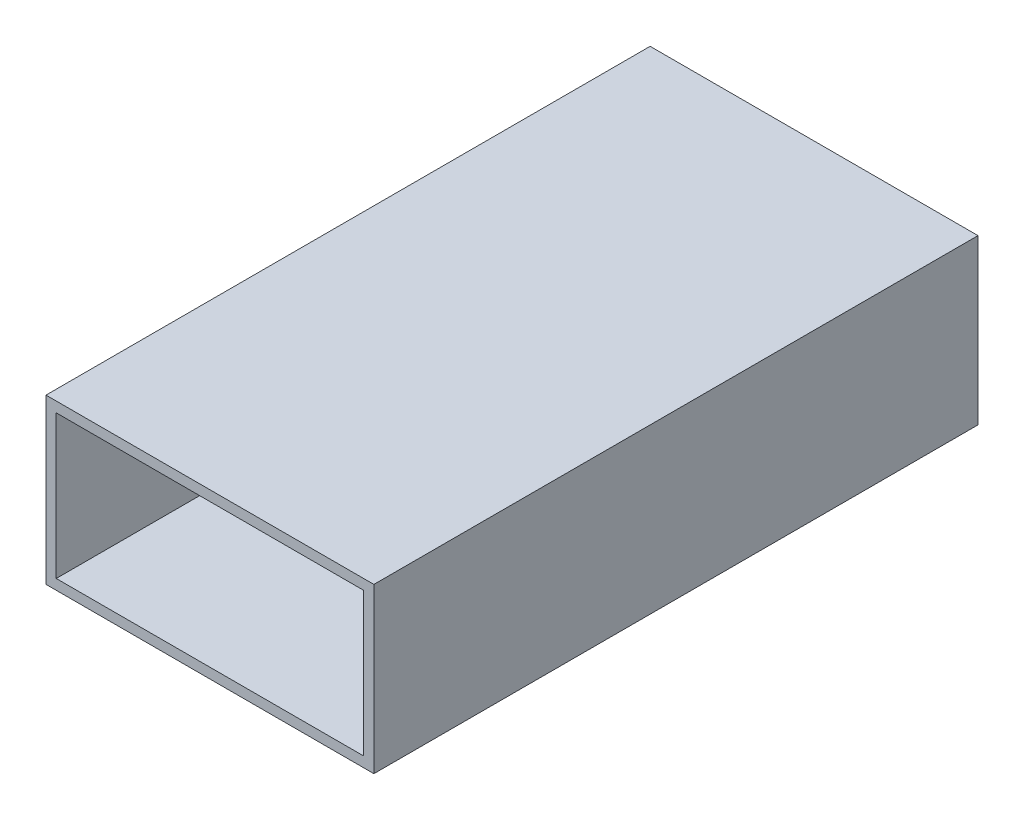
from build123d import *

# Parameters (mm, degrees)
SKETCH1_W           = 50.8
SKETCH1_H           = 25.4
SKETCH1_W_2         = 47.625
SKETCH1_H_2         = 22.225
BOSS_EXTRUDE1_DEPTH = 46.7995


with BuildPart() as part:
    # Sketch1 → Boss-Extrude1 (new, symmetric)
    with BuildSketch(Plane.XY):
        Rectangle(SKETCH1_W, SKETCH1_H)
        Rectangle(SKETCH1_W_2, SKETCH1_H_2, mode=Mode.SUBTRACT)
    extrude(amount=BOSS_EXTRUDE1_DEPTH, both=True)


solid = part.part
